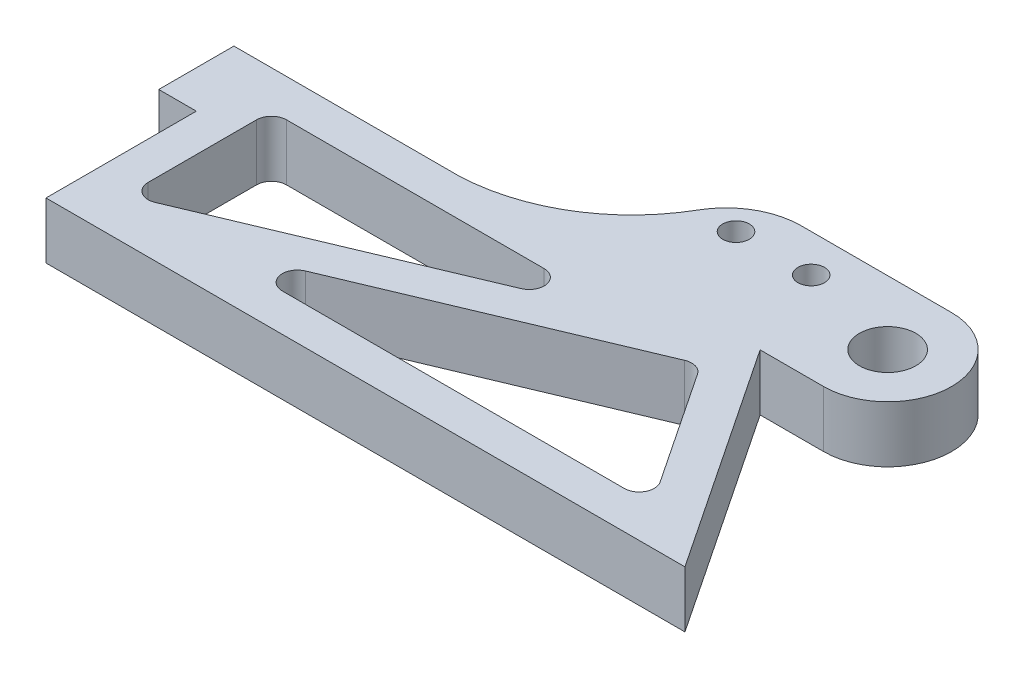
from build123d import *

# Parameters (mm, degrees)
SKETCH1_R           = 4.7625
SKETCH1_R_2         = 2.2479
BOSS_EXTRUDE1_DEPTH = 9.525
FILLET6_R           = 2.54


with BuildPart() as part:
    # Sketch1 → Boss-Extrude1 (new body)
    with BuildSketch(Plane(origin=(0, 0, 0), x_dir=(1, 0, 0), z_dir=(0, 1, 0))):
        with BuildLine():
            Line((0, 0), (38.1, 0))
            ThreePointArc((38.1, 0), (52.620300687, 4.403064286), (63.218539249, 15.261399634))
            ThreePointArc((63.218539249, 15.261399634), (67.86863694, 19.924564568), (74.228922018, 21.631986448))
            Line((74.228922018, 21.631986448), (99.628922018, 21.631986448))
            ThreePointArc((99.628922018, 21.631986448), (110.444915242, 10.815993224), (99.628922018, 0))
            Line((99.628922018, 0), (88.9, 0))
            Line((88.9, 0), (114.3, -38.1))
            Line((114.3, -38.1), (6.35, -38.1))
            Line((6.35, -38.1), (6.35, -12.7))
            Line((6.35, -12.7), (0, -12.7))
            Line((0, -12.7), (0, 0))
        make_face()
        with Locations((99.628922018, 10.815993224)):
            Circle(SKETCH1_R, mode=Mode.SUBTRACT)
        with Locations((69.568539249, 15.261399634)):
            Circle(SKETCH1_R_2, mode=Mode.SUBTRACT)
        with Locations((82.268539249, 15.261399634)):
            Circle(SKETCH1_R_2, mode=Mode.SUBTRACT)
        Polygon((85.993351145, -7.087652017), (102.434916467, -31.75), (27.330311809, -31.75), align=None, mode=Mode.SUBTRACT)
        Polygon((12.7, -31.012347983), (12.7, -6.35), (71.363039336, -6.35), align=None, mode=Mode.SUBTRACT)
    extrude(amount=BOSS_EXTRUDE1_DEPTH)

    # Fillet6
    fillet6_edges = [part.edges().sort_by_distance(p)[0] for p in [
        (102.434916467, 4.7625, 31.75),
        (85.993351145, 4.7625, 7.087652017),
        (27.330311809, 4.7625, 31.75),
        (12.7, 4.7625, 31.012347983),
        (12.7, 4.7625, 6.35),
        (71.363039336, 4.7625, 6.35),
    ]]
    fillet(fillet6_edges, radius=FILLET6_R)


solid = part.part
